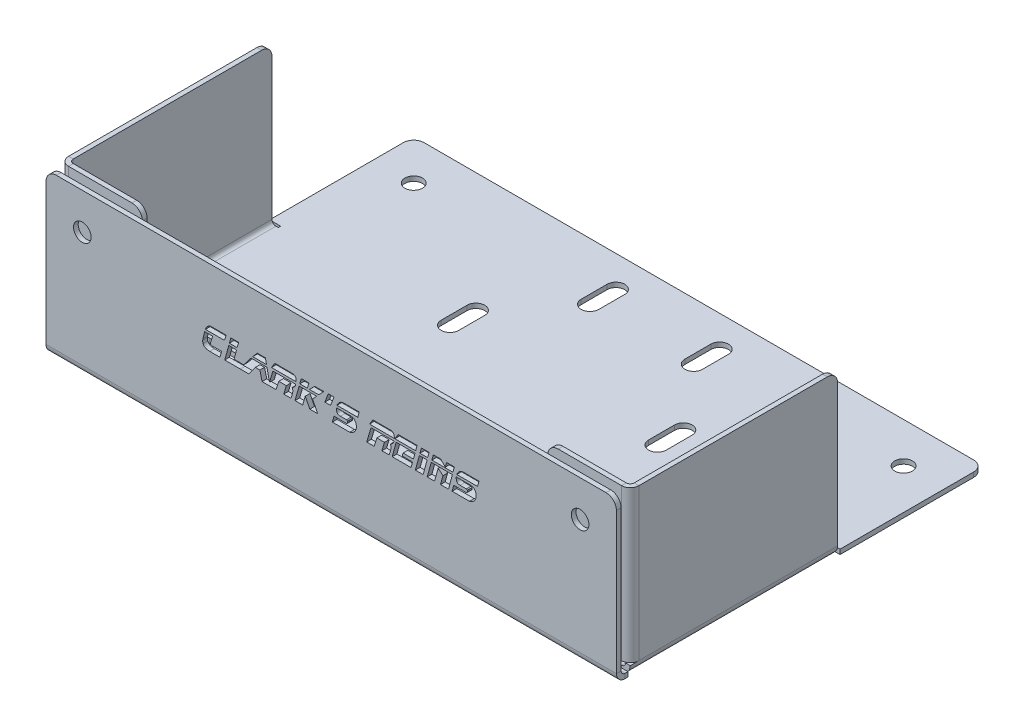
from build123d import *

# Parameters (mm, degrees)
SKETCH1_W                     = 110
SKETCH1_H                     = 70
BASE_FLANGE1_DEPTH            = 0.91
EDGE_FLANGE1_STRIP_W          = 5.164
EDGE_FLANGE1_STRIP_H          = 0.91
EDGE_FLANGE1_STRIP_CUT_DEPTH  = 110
EDGE_FLANGE1_DEPTH            = 110
EDGE_FLANGE2_STRIP_W          = 5.164
EDGE_FLANGE2_STRIP_H          = 0.91
EDGE_FLANGE2_STRIP_CUT_DEPTH  = 40
EDGE_FLANGE2_RELIEF_W         = 5.619
EDGE_FLANGE2_RELIEF_H         = 0.455
EDGE_FLANGE2_RELIEF_CUT_DEPTH = 0.91
EDGE_FLANGE2_DEPTH            = 40
EDGE_FLANGE3_START            = 0.762
EDGE_FLANGE3_DEPTH            = 29.238
EDGE_FLANGE3_2_DEPTH          = 29.238
M3_CLEARANCE_HOLE3_D          = 3.4
M3_CLEARANCE_HOLE1_D          = 3.4
COPY_OF_M3_HOLES_COPY_1_D     = 3.4
CLARK_S_REINS_DEPTH           = 0.91
M3_CLEARANCE_HOLE2_D          = 3.4
CUT_EXTRUDE2_DEPTH            = 134.790881707
M3_CLEARANCE_HOLE4_D          = 3.4
CUT_EXTRUDE3_DEPTH            = 134.790881707
FILLET1_R                     = 2


# Read off the part's stored shape, not the designer's step: Edge-Flange3
# Sheet-metal steps are written as plain solids
with BuildPart() as part:
    # Sketch1 → Base-Flange1 (new body)
    with BuildSketch(Plane(origin=(0, 0, 0), x_dir=(1, 0, 0), z_dir=(0, 1, 0))):
        with Locations((55, 35)):
            Rectangle(SKETCH1_W, SKETCH1_H)
    extrude(amount=-BASE_FLANGE1_DEPTH)

    # Edge-Flange1 strip (across the edge) → Edge-Flange1 strip cut (cut)
    with BuildSketch(Plane(origin=(0, 0, 0), x_dir=(0, 0, -1), z_dir=(1, 0, 0))):
        with Locations((-1.82, -0.455)):
            Rectangle(EDGE_FLANGE1_STRIP_W, EDGE_FLANGE1_STRIP_H)
    extrude(amount=EDGE_FLANGE1_STRIP_CUT_DEPTH, mode=Mode.SUBTRACT)

    # Edge-Flange1 section (across the edge) → Edge-Flange1 (add)
    with BuildSketch(Plane(origin=(0, 0, 0), x_dir=(0, 0, -1), z_dir=(1, 0, 0))):
        with BuildLine():
            Line((-0.91, 0.762), (-0.91, 30))
            Line((-0.91, 30), (0, 30))
            Line((0, 30), (0, 0.762))
            ThreePointArc((0, 0.762), (0.223184633, 0.223184633), (0.762, 0))
            Line((0.762, 0), (0.762, -0.91))
            ThreePointArc((0.762, -0.91), (-0.420282538, -0.420282538), (-0.91, 0.762))
        make_face()
    extrude(amount=EDGE_FLANGE1_DEPTH)

    # Edge-Flange2 strip (across the edge) → Edge-Flange2 strip cut (cut)
    with BuildSketch(Plane(origin=(110, 0, -1.762), x_dir=(-1, 0, 0), z_dir=(0, 0, -1))):
        with Locations((-0.91, -0.455)):
            Rectangle(EDGE_FLANGE2_STRIP_W, EDGE_FLANGE2_STRIP_H)
    edge_flange2_strip_cut = extrude(amount=EDGE_FLANGE2_STRIP_CUT_DEPTH, mode=Mode.SUBTRACT)

    # Edge-Flange2 relief (on the sheet) → Edge-Flange2 relief cut (cut)
    with BuildSketch(Plane(origin=(108.328, 0, -1.762), x_dir=(-1, 0, 0), z_dir=(0, 1, 0))):
        with Locations((-2.3545, 0.2275)):
            Rectangle(EDGE_FLANGE2_RELIEF_W, EDGE_FLANGE2_RELIEF_H)
        with Locations((-2.3545, -40.2275)):
            Rectangle(EDGE_FLANGE2_RELIEF_W, EDGE_FLANGE2_RELIEF_H)
    edge_flange2_relief_cut = extrude(amount=-EDGE_FLANGE2_RELIEF_CUT_DEPTH, mode=Mode.SUBTRACT)

    # Edge-Flange2 section (across the edge) → Edge-Flange2 (add)
    with BuildSketch(Plane(origin=(110, 0, -1.762), x_dir=(-1, 0, 0), z_dir=(0, 0, -1))):
        with BuildLine():
            Line((0, 0.762), (0, 30))
            Line((0, 30), (0.91, 30))
            Line((0.91, 30), (0.91, 0.762))
            ThreePointArc((0.91, 0.762), (1.133184633, 0.223184633), (1.672, 0))
            Line((1.672, 0), (1.672, -0.91))
            ThreePointArc((1.672, -0.91), (0.489717462, -0.420282538), (0, 0.762))
        make_face()
    edge_flange2 = extrude(amount=EDGE_FLANGE2_DEPTH)

    # Edge-Flange3 outline → Edge-Flange3 (cut)
    with BuildSketch(Plane(origin=(0, 0, 0), x_dir=(1, 0, 0), z_dir=(0, 1, 0)).offset(EDGE_FLANGE3_START)):
        with BuildLine():
            ThreePointArc((110, 3.434), (109.754472572, 2.56178443), (109.09, 1.945732551))
            Line((109.09, 1.945732551), (109.09, 1.762))
            Line((109.09, 1.762), (110, 1.762))
            Line((110, 1.762), (110, 3.434))
        make_face()
    edge_flange3 = extrude(amount=EDGE_FLANGE3_DEPTH, mode=Mode.SUBTRACT)

    # Edge-Flange3 2 outline → Edge-Flange3 2 (add)
    with BuildSketch(Plane(origin=(0, 0, 0), x_dir=(1, 0, 0), z_dir=(0, 1, 0)).offset(EDGE_FLANGE3_START)):
        with BuildLine():
            Line((94.09, 1.762), (108.328, 1.762))
            ThreePointArc((108.328, 1.762), (108.719918885, 1.808582027), (109.09, 1.945732551))
            Line((109.09, 1.945732551), (109.09, 3.434))
            ThreePointArc((109.09, 3.434), (108.866815367, 2.895184633), (108.328, 2.672))
            Line((108.328, 2.672), (94.09, 2.672))
            Line((94.09, 2.672), (94.09, 1.762))
        make_face()
    edge_flange3_2 = extrude(amount=EDGE_FLANGE3_2_DEPTH)

    # M3 Clearance Hole3 (through all)
    with Locations(Plane.XY.offset(0.91)):
        with Locations((103, 23)):
            m3_clearance_hole3 = Hole(M3_CLEARANCE_HOLE3_D / 2)

    # Mirror6: Edge-Flange2 strip cut, Edge-Flange2 relief cut, Edge-Flange2, Edge-Flange3, Edge-Flange3 2, M3 Clearance Hole3 across plane
    add(edge_flange2_strip_cut.mirror(Plane(origin=(55, 0, 0), x_dir=(0, 0, 1), z_dir=(1, 0, 0))), mode=Mode.SUBTRACT)
    add(edge_flange2_relief_cut.mirror(Plane(origin=(55, 0, 0), x_dir=(0, 0, 1), z_dir=(1, 0, 0))), mode=Mode.SUBTRACT)
    add(edge_flange2.mirror(Plane(origin=(55, 0, 0), x_dir=(0, 0, 1), z_dir=(1, 0, 0))))
    add(edge_flange3.mirror(Plane(origin=(55, 0, 0), x_dir=(0, 0, 1), z_dir=(1, 0, 0))), mode=Mode.SUBTRACT)
    add(edge_flange3_2.mirror(Plane(origin=(55, 0, 0), x_dir=(0, 0, 1), z_dir=(1, 0, 0))))
    add(m3_clearance_hole3.mirror(Plane(origin=(55, 0, 0), x_dir=(0, 0, 1), z_dir=(1, 0, 0))), mode=Mode.SUBTRACT)

    # M3 Clearance Hole1 (through all)
    with Locations(Plane(origin=(0, 0, 0), x_dir=(1, 0, 0), z_dir=(0, 1, 0))):
        with Locations((7.762, 62.238)):
            m3_clearance_hole1 = Hole(M3_CLEARANCE_HOLE1_D / 2)

    # Copy of M3 Hole: M3 Clearance Hole1 across plane
    add(m3_clearance_hole1.mirror(Plane.XY.offset(-35)), mode=Mode.SUBTRACT)

    # Copy of M3 Holes: M3 Clearance Hole1 across plane
    add(m3_clearance_hole1.mirror(Plane(origin=(55, 0, 0), x_dir=(0, 0, 1), z_dir=(1, 0, 0))), mode=Mode.SUBTRACT)

    # Copy of M3 Holes copy 1 (through all)
    with Locations(Plane(origin=(110, 0, -70), x_dir=(-1, 0, 0), z_dir=(0, 1, 0))):
        with Locations((7.762, 62.238)):
            Hole(COPY_OF_M3_HOLES_COPY_1_D / 2)

    # Sketch28 → Clark's Reins (cut)
    with BuildSketch(Plane.XY.offset(0.91)):
        with BuildLine():
            Line((34.736062337, 19.669454861), (34.431403356, 18.640225694))
            Line((34.431403356, 18.640225694), (30.735291323, 18.640225694))
            add(Edge.make_bspline(
                [(30.735291323, 18.640225694), (30.74517346, 18.671694178), (30.764938942, 18.734634998), (30.804303251, 18.825411557), (30.847787537, 18.9148253), (30.899310195, 19.001043126), (30.955283862, 19.086211161), (31.018039553, 19.168792297), (31.088027933, 19.248090393), (31.137991213, 19.298907773), (31.163243381, 19.324591616)],
                knots=[0, 0, 0, 0, 0.969584053, 1.939286824, 2.906969419, 3.892567764, 4.891161531, 5.903872825, 6.940586855, 8, 8, 8, 8], degree=3))
            add(Edge.make_bspline(
                [(31.163243381, 19.324591616), (31.192365751, 19.35179938), (31.249227354, 19.404922702), (31.338382225, 19.47581139), (31.429517546, 19.535232057), (31.52081533, 19.584388093), (31.613235366, 19.622770424), (31.706450108, 19.6494867), (31.800837249, 19.666363866), (31.864217987, 19.668425699), (31.89585442, 19.669454861)],
                knots=[0, 0, 0, 0, 1.151042241, 2.247416924, 3.285395898, 4.289929018, 5.238920285, 6.170118847, 7.086616619, 8, 8, 8, 8], degree=3))
            Line((31.89585442, 19.669454861), (34.736062337, 19.669454861))
        make_face()
        with BuildLine():
            Line((33.861396231, 16.524587963), (33.538868689, 15.381))
            Line((33.538868689, 15.381), (31.582261158, 15.381))
            add(Edge.make_bspline(
                [(31.582261158, 15.381), (31.540859722, 15.381606912), (31.459781603, 15.382795453), (31.341018016, 15.389370623), (31.228097249, 15.403225568), (31.120786119, 15.421067928), (31.018689685, 15.442610801), (30.923173077, 15.471729298), (30.833073298, 15.504497816), (30.749124078, 15.543265244), (30.670066293, 15.58569746), (30.597342687, 15.634471076), (30.529994349, 15.687859652), (30.469276495, 15.747369075), (30.413365998, 15.811041222), (30.363218656, 15.879977306), (30.319186131, 15.954170897), (30.295252775, 16.006756996), (30.283216706, 16.03320251)],
                knots=[0, 0, 0, 0, 1.285130438, 2.516723288, 3.689614434, 4.814121375, 5.892908561, 6.925234272, 7.910815483, 8.866288762, 9.792843532, 10.692686491, 11.58048512, 12.456415222, 13.327699743, 14.207765629, 15.098686514, 16, 16, 16, 16], degree=3))
            add(Edge.make_bspline(
                [(30.283216706, 16.03320251), (30.270503366, 16.068641638), (30.243279643, 16.14452925), (30.223859175, 16.272814612), (30.217949637, 16.41923666), (30.22498601, 16.522524068), (30.228717593, 16.577300221)],
                knots=[0, 0, 0, 0, 0.817267469, 1.750056471, 2.806793075, 4, 4, 4, 4], degree=3))
            add(Edge.make_bspline(
                [(30.228717593, 16.577300221), (30.230261322, 16.590993738), (30.233883209, 16.623121382), (30.238518779, 16.678058636), (30.247485204, 16.746388766), (30.252678106, 16.796472886), (30.255520435, 16.823886375)],
                knots=[0, 0, 0, 0, 0.666647788, 1.56408479, 2.666704423, 4, 4, 4, 4], degree=3))
            Line((30.255520435, 16.823886375), (30.61467853, 18.194405075))
            Line((30.61467853, 18.194405075), (32.146014287, 18.203339355))
            Line((32.146014287, 18.203339355), (31.702873951, 16.838181225))
            add(Edge.make_bspline(
                [(31.702873951, 16.838181225), (31.709864958, 16.811114751), (31.723811967, 16.757117322), (31.736070769, 16.702711801), (31.742184787, 16.675577311)],
                knots=[0, 0, 0, 0, 1.002509712, 2, 2, 2, 2], degree=3))
            add(Edge.make_bspline(
                [(31.742184787, 16.675577311), (31.753162774, 16.65725451), (31.775499957, 16.619972651), (31.828281271, 16.576523619), (31.894578281, 16.54418357), (31.944375778, 16.531398458), (31.97090238, 16.524587963)],
                knots=[0, 0, 0, 0, 0.898606002, 1.828415905, 2.843220022, 4, 4, 4, 4], degree=3))
            Line((31.97090238, 16.524587963), (33.861396231, 16.524587963))
        make_face()
        Polygon((37.161719618, 19.669454861), (36.857060637, 18.640225694), (35.361462004, 18.640225694), (35.644678711, 19.66052058), align=None)
        Polygon((38.324962999, 16.410229167), (37.462804886, 15.381), (34.459993056, 15.381), (35.256037489, 18.203339355), (36.754316406, 18.203339355), (36.259357241, 16.410229167), align=None)
        Polygon((42.525861907, 18.640225694), (39.860765896, 18.640225694), (40.747046568, 19.669454861), (42.306078595, 19.669454861), align=None)
        Polygon((43.213801541, 15.381), (41.663703794, 15.381), (41.244686017, 17.096381944), (40.370019911, 17.096381944), (39.128154857, 15.381), (37.318962963, 15.383680284), (39.529304073, 18.239969907), (42.610737576, 18.239969907), align=None)
        with BuildLine():
            Line((48.250949146, 18.640225694), (43.464854836, 18.640225694))
            Line((43.464854836, 18.640225694), (44.118844202, 19.669454861))
            Line((44.118844202, 19.669454861), (47.632696904, 19.669454861))
            add(Edge.make_bspline(
                [(47.632696904, 19.669454861), (47.656663709, 19.66829251), (47.705680326, 19.665915283), (47.778933037, 19.644279786), (47.853502533, 19.612573905), (47.900528513, 19.582343971), (47.924847891, 19.56671063)],
                knots=[0, 0, 0, 0, 0.913581768, 1.868446239, 2.897671833, 4, 4, 4, 4], degree=3))
            add(Edge.make_bspline(
                [(47.924847891, 19.56671063), (47.947610654, 19.550257082), (47.992079184, 19.518114012), (48.050301072, 19.46204597), (48.100522146, 19.402172921), (48.12644398, 19.358042712), (48.139270634, 19.336206181)],
                knots=[0, 0, 0, 0, 1.059583365, 2.069964611, 3.044978977, 4, 4, 4, 4], degree=3))
            add(Edge.make_bspline(
                [(48.139270634, 19.336206181), (48.14825905, 19.317896274), (48.167423646, 19.278856914), (48.190120117, 19.21384992), (48.208421048, 19.139537435), (48.224770391, 19.057039352), (48.235575845, 18.965297782), (48.244801392, 18.864931181), (48.249973515, 18.755531415), (48.250616486, 18.679541355), (48.250949146, 18.640225694)],
                knots=[0, 0, 0, 0, 0.68813208, 1.467196756, 2.318188026, 3.270514463, 4.304265893, 5.434736438, 6.672786523, 8, 8, 8, 8], degree=3))
        make_face()
        with BuildLine():
            add(Edge.make_bspline(
                [(48.178581471, 18.182790509), (48.173358263, 18.151650574), (48.162815637, 18.08879711), (48.133300134, 17.996770032), (48.094803328, 17.906102571), (48.046003892, 17.816948674), (47.98661799, 17.729162974), (47.916681992, 17.642815726), (47.837064733, 17.557249359), (47.777586363, 17.504208538), (47.7470557, 17.476982313)],
                knots=[0, 0, 0, 0, 0.89522961, 1.806949233, 2.734865869, 3.688117976, 4.686871091, 5.73903451, 6.839430601, 8, 8, 8, 8], degree=3))
            add(Edge.make_bspline(
                [(47.7470557, 17.476982313), (47.719040473, 17.453398062), (47.667046277, 17.40962743), (47.59050215, 17.353668867), (47.522639018, 17.310475715), (47.477775756, 17.290986245), (47.457584997, 17.282214988)],
                knots=[0, 0, 0, 0, 1.253750942, 2.326869253, 3.247005745, 4, 4, 4, 4], degree=3))
            add(Edge.make_bspline(
                [(47.457584997, 17.282214988), (47.47961959, 17.245581686), (47.522590541, 17.174140935), (47.566260764, 17.058045194), (47.594498802, 16.939909272), (47.597930524, 16.859483834), (47.599640064, 16.819419235)],
                knots=[0, 0, 0, 0, 1.043583065, 2.035152543, 3.021194923, 4, 4, 4, 4], degree=3))
            add(Edge.make_bspline(
                [(47.599640064, 16.819419235), (47.599039945, 16.793195464), (47.597721565, 16.735585467), (47.588680722, 16.642383353), (47.576657428, 16.534399133), (47.564268252, 16.458127252), (47.557648944, 16.417376591)],
                knots=[0, 0, 0, 0, 0.77775057, 1.708610381, 2.775752775, 4, 4, 4, 4], degree=3))
            add(Edge.make_bspline(
                [(47.557648944, 16.417376591), (47.554256562, 16.400062065), (47.545946084, 16.357645849), (47.525461333, 16.283905826), (47.496356798, 16.187960767), (47.460010249, 16.069631519), (47.415059801, 15.928756613), (47.36146186, 15.765946015), (47.29986242, 15.580590046), (47.255183517, 15.450055035), (47.231547689, 15.381)],
                knots=[0, 0, 0, 0, 0.389472445, 0.95410909, 1.688508646, 2.603699675, 3.68718707, 4.953583, 6.388398418, 8, 8, 8, 8], degree=3))
            Line((47.231547689, 15.381), (45.847627568, 15.381))
            Line((45.847627568, 15.381), (46.341693305, 17.039202546))
            Line((46.341693305, 17.039202546), (44.885405509, 17.039202546))
            Line((44.885405509, 17.039202546), (44.360963216, 15.381))
            Line((44.360963216, 15.381), (42.922543981, 15.381))
            Line((42.922543981, 15.381), (43.751645255, 18.182790509))
            Line((43.751645255, 18.182790509), (48.178581471, 18.182790509))
        make_face()
        Polygon((53.578460883, 19.669454861), (52.592116265, 18.640225694), (50.804366645, 18.640225694), (51.808579825, 19.669454861), align=None)
        Polygon((50.701622414, 19.669454861), (50.405897714, 18.640225694), (48.940675637, 18.640225694), (49.236400336, 19.669454861), align=None)
        Polygon((52.410750362, 15.381), (50.869586896, 15.381), (49.998494502, 17.106209654), (49.504428765, 15.381), (48.011510417, 15.381), (48.825423412, 18.203339355), (52.217769893, 18.203339355), (51.392242332, 17.368877514), align=None)
        Polygon((54.429897859, 19.726634259), (55.532388129, 19.726634259), (54.877505335, 18.011252315), (53.775015064, 18.011252315), align=None)
        with BuildLine():
            Line((60.3935304, 19.669454861), (60.119247975, 18.640225694))
            Line((60.119247975, 18.640225694), (56.114903248, 18.640225694))
            add(Edge.make_bspline(
                [(56.114903248, 18.640225694), (56.125706931, 18.671695495), (56.147336369, 18.734699387), (56.189098817, 18.825740916), (56.236817243, 18.914965542), (56.290868566, 19.002008472), (56.35227273, 19.086628407), (56.420157937, 19.168538652), (56.494563073, 19.248691823), (56.548490825, 19.29900715), (56.575912146, 19.324591616)],
                knots=[0, 0, 0, 0, 0.956209675, 1.914372872, 2.87597378, 3.864460707, 4.857942359, 5.879804516, 6.921917604, 8, 8, 8, 8], degree=3))
            add(Edge.make_bspline(
                [(56.575912146, 19.324591616), (56.60741799, 19.351833094), (56.669075827, 19.405145443), (56.765299971, 19.475747045), (56.862820446, 19.535332817), (56.960583881, 19.584737413), (57.059726465, 19.622640472), (57.159103073, 19.649425134), (57.259396877, 19.666426392), (57.326623194, 19.668443258), (57.360342014, 19.669454861)],
                knots=[0, 0, 0, 0, 1.139603552, 2.230236676, 3.261863858, 4.264259599, 5.223960264, 6.161141691, 7.077680667, 8, 8, 8, 8], degree=3))
            Line((57.360342014, 19.669454861), (60.3935304, 19.669454861))
        make_face()
        with BuildLine():
            add(Edge.make_bspline(
                [(59.836031268, 16.706847295), (59.831055707, 16.666160344), (59.821067204, 16.584480761), (59.788029782, 16.464330362), (59.745886159, 16.344736606), (59.688299336, 16.227664851), (59.620503379, 16.110591894), (59.538525233, 15.996005247), (59.445731324, 15.881391008), (59.37535503, 15.809870936), (59.339285247, 15.773214934)],
                knots=[0, 0, 0, 0, 0.910421112, 1.827682268, 2.764157645, 3.72689346, 4.724227412, 5.769787089, 6.856954621, 8, 8, 8, 8], degree=3))
            add(Edge.make_bspline(
                [(59.339285247, 15.773214934), (59.317631911, 15.752519871), (59.273225479, 15.710078655), (59.197515555, 15.653457613), (59.11399518, 15.599846724), (59.022807563, 15.548884512), (58.923168709, 15.501355123), (58.81483156, 15.458188391), (58.69880596, 15.416628528), (58.617830537, 15.393078818), (58.576297653, 15.381)],
                knots=[0, 0, 0, 0, 0.828618772, 1.699322615, 2.61184683, 3.575250122, 4.589426627, 5.665778724, 6.802760923, 8, 8, 8, 8], degree=3))
            Line((58.576297653, 15.381), (55.216114583, 15.389934281))
            Line((55.216114583, 15.389934281), (55.545789551, 16.560325087))
            Line((55.545789551, 16.560325087), (57.886571162, 16.524587963))
            add(Edge.make_bspline(
                [(57.886571162, 16.524587963), (57.910246456, 16.528088224), (57.955292824, 16.534748081), (58.017561107, 16.554712692), (58.071549091, 16.58068722), (58.114225432, 16.616834605), (58.148991536, 16.659054589), (58.172624564, 16.709742735), (58.187536143, 16.76765096), (58.188785789, 16.808596821), (58.189443287, 16.830140372)],
                knots=[0, 0, 0, 0, 1.192376395, 2.26870371, 3.252393677, 4.160059601, 5.037409856, 5.961355377, 6.927372829, 8, 8, 8, 8], degree=3))
            add(Edge.make_bspline(
                [(58.189443287, 16.830140372), (58.189167854, 16.853987162), (58.188667749, 16.897285763), (58.183708942, 16.955545464), (58.1753402, 17.001229902), (58.163932523, 17.025343502), (58.159066732, 17.035628834)],
                knots=[0, 0, 0, 0, 1.364590242, 2.477685587, 3.350677278, 4, 4, 4, 4], degree=3))
            add(Edge.make_bspline(
                [(58.159066732, 17.035628834), (58.150661048, 17.046895001), (58.131704333, 17.072302753), (58.086386545, 17.100966455), (58.028569785, 17.130114744), (57.983635132, 17.145245441), (57.958938838, 17.153561343)],
                knots=[0, 0, 0, 0, 0.708538637, 1.597914665, 2.679802781, 4, 4, 4, 4], degree=3))
            Line((57.958938838, 17.153561343), (56.762638618, 17.153561343))
            add(Edge.make_bspline(
                [(56.762638618, 17.153561343), (56.731346851, 17.153979459), (56.670709756, 17.154789685), (56.583143796, 17.16372828), (56.501808878, 17.178861168), (56.427041478, 17.200152108), (56.358261955, 17.226891383), (56.296042807, 17.260036587), (56.240512506, 17.299692657), (56.190267594, 17.344639074), (56.147291628, 17.397426731), (56.109166261, 17.456792971), (56.078259906, 17.524696185), (56.052300451, 17.599729534), (56.033076431, 17.68245043), (56.018927589, 17.772314303), (56.009752318, 17.869603826), (56.008982893, 17.937076174), (56.008585305, 17.971941479)],
                knots=[0, 0, 0, 0, 1.166842435, 2.261103934, 3.278525226, 4.248956773, 5.156576421, 6.026289423, 6.87080885, 7.696489042, 8.532786248, 9.401789569, 10.321161014, 11.308296568, 12.359069103, 13.484023017, 14.699907341, 16, 16, 16, 16], degree=3))
            add(Edge.make_bspline(
                [(56.008585305, 17.971941479), (56.007107065, 17.988321486), (56.00433957, 18.018987413), (56.000314582, 18.061820966), (55.998921263, 18.098222444), (55.997463261, 18.127941107), (55.998440298, 18.151098325), (55.999937726, 18.167258536), (56.002340963, 18.17865141), (56.006954062, 18.181709231), (56.008585305, 18.182790509)],
                knots=[0, 0, 0, 0, 1.84323671, 3.450826295, 4.820859661, 5.922765388, 6.791176808, 7.395637569, 7.786290849, 8, 8, 8, 8], degree=3))
            Line((56.008585305, 18.182790509), (58.727287001, 18.182790509))
            add(Edge.make_bspline(
                [(58.727287001, 18.182790509), (58.767233333, 18.177089138), (58.843730438, 18.166171031), (58.953080403, 18.146443472), (59.052342207, 18.125114611), (59.141983252, 18.102293765), (59.221400963, 18.076636297), (59.290546952, 18.0487441), (59.35043014, 18.020375946), (59.384224378, 17.996510644), (59.400038357, 17.9853429)],
                knots=[0, 0, 0, 0, 1.369144754, 2.621908043, 3.769545441, 4.813699606, 5.759636069, 6.598458342, 7.344149999, 8, 8, 8, 8], degree=3))
            add(Edge.make_bspline(
                [(59.400038357, 17.9853429), (59.403627093, 17.981783905), (59.413647387, 17.971846654), (59.432843616, 17.95143428), (59.461127733, 17.921352086), (59.498952128, 17.881392664), (59.543736166, 17.829808707), (59.600024094, 17.770711442), (59.662857456, 17.699340719), (59.708767526, 17.649323916), (59.733287037, 17.622611093)],
                knots=[0, 0, 0, 0, 0.246230822, 0.687513659, 1.364959245, 2.258076485, 3.367823802, 4.692308244, 6.233438043, 8, 8, 8, 8], degree=3))
            add(Edge.make_bspline(
                [(59.733287037, 17.622611093), (59.75106569, 17.572305408), (59.787256835, 17.469900552), (59.821705484, 17.3069853), (59.8439038, 17.134527735), (59.846376389, 17.016048417), (59.847645833, 16.955220305)],
                knots=[0, 0, 0, 0, 0.939554019, 1.912604809, 2.92831669, 4, 4, 4, 4], degree=3))
            add(Edge.make_bspline(
                [(59.847645833, 16.955220305), (59.847271215, 16.913800558), (59.846521099, 16.830863682), (59.839530614, 16.748218437), (59.836031268, 16.706847295)],
                knots=[0, 0, 0, 0, 0.998825835, 2, 2, 2, 2], degree=3))
        make_face()
        with BuildLine():
            Line((67.177329933, 18.640225694), (62.391235623, 18.640225694))
            Line((62.391235623, 18.640225694), (63.045224989, 19.669454861))
            Line((63.045224989, 19.669454861), (66.559077691, 19.669454861))
            add(Edge.make_bspline(
                [(66.559077691, 19.669454861), (66.583044496, 19.66829251), (66.632061113, 19.665915283), (66.705313824, 19.644279786), (66.77988332, 19.612573905), (66.8269093, 19.582343971), (66.851228678, 19.56671063)],
                knots=[0, 0, 0, 0, 0.913581768, 1.868446239, 2.897671833, 4, 4, 4, 4], degree=3))
            add(Edge.make_bspline(
                [(66.851228678, 19.56671063), (66.873991441, 19.550257082), (66.918459971, 19.518114012), (66.976681859, 19.46204597), (67.026902933, 19.402172921), (67.052824767, 19.358042712), (67.065651421, 19.336206181)],
                knots=[0, 0, 0, 0, 1.059583365, 2.069964611, 3.044978977, 4, 4, 4, 4], degree=3))
            add(Edge.make_bspline(
                [(67.065651421, 19.336206181), (67.074639837, 19.317896274), (67.093804433, 19.278856914), (67.116500904, 19.21384992), (67.134801835, 19.139537435), (67.151151178, 19.057039352), (67.161956632, 18.965297782), (67.171182179, 18.864931181), (67.176354302, 18.755531415), (67.176997273, 18.679541355), (67.177329933, 18.640225694)],
                knots=[0, 0, 0, 0, 0.68813208, 1.467196756, 2.318188026, 3.270514463, 4.304265893, 5.434736438, 6.672786523, 8, 8, 8, 8], degree=3))
        make_face()
        with BuildLine():
            add(Edge.make_bspline(
                [(67.104962258, 18.182790509), (67.09973905, 18.151650574), (67.089196424, 18.08879711), (67.059680921, 17.996770032), (67.021184115, 17.906102571), (66.97238468, 17.816948674), (66.912998777, 17.729162974), (66.843062779, 17.642815726), (66.76344552, 17.557249359), (66.70396715, 17.504208538), (66.673436487, 17.476982313)],
                knots=[0, 0, 0, 0, 0.89522961, 1.806949233, 2.734865869, 3.688117976, 4.686871091, 5.73903451, 6.839430601, 8, 8, 8, 8], degree=3))
            add(Edge.make_bspline(
                [(66.673436487, 17.476982313), (66.64542126, 17.453398062), (66.593427064, 17.40962743), (66.516882937, 17.353668867), (66.449019805, 17.310475715), (66.404156543, 17.290986245), (66.383965784, 17.282214988)],
                knots=[0, 0, 0, 0, 1.253750942, 2.326869253, 3.247005745, 4, 4, 4, 4], degree=3))
            add(Edge.make_bspline(
                [(66.383965784, 17.282214988), (66.406000377, 17.245581686), (66.448971328, 17.174140935), (66.492641551, 17.058045194), (66.520879589, 16.939909272), (66.524311311, 16.859483834), (66.526020851, 16.819419235)],
                knots=[0, 0, 0, 0, 1.043583065, 2.035152543, 3.021194923, 4, 4, 4, 4], degree=3))
            add(Edge.make_bspline(
                [(66.526020851, 16.819419235), (66.525420732, 16.793195464), (66.524102352, 16.735585467), (66.515061509, 16.642383353), (66.503038215, 16.534399133), (66.490649039, 16.458127252), (66.484029731, 16.417376591)],
                knots=[0, 0, 0, 0, 0.77775057, 1.708610381, 2.775752775, 4, 4, 4, 4], degree=3))
            add(Edge.make_bspline(
                [(66.484029731, 16.417376591), (66.480637349, 16.400062065), (66.472326871, 16.357645849), (66.45184212, 16.283905826), (66.422737585, 16.187960767), (66.386391036, 16.069631519), (66.341440588, 15.928756613), (66.287842647, 15.765946015), (66.226243207, 15.580590046), (66.181564304, 15.450055035), (66.157928476, 15.381)],
                knots=[0, 0, 0, 0, 0.389472445, 0.95410909, 1.688508646, 2.603699675, 3.68718707, 4.953583, 6.388398418, 8, 8, 8, 8], degree=3))
            Line((66.157928476, 15.381), (64.774008355, 15.381))
            Line((64.774008355, 15.381), (65.268074092, 17.039202546))
            Line((65.268074092, 17.039202546), (63.811786296, 17.039202546))
            Line((63.811786296, 17.039202546), (63.287344003, 15.381))
            Line((63.287344003, 15.381), (61.848924769, 15.381))
            Line((61.848924769, 15.381), (62.678026042, 18.182790509))
            Line((62.678026042, 18.182790509), (67.104962258, 18.182790509))
        make_face()
        Polygon((71.563168457, 19.669454861), (71.288886032, 18.640225694), (67.266672743, 18.640225694), (67.92959639, 19.669454861), align=None)
        Polygon((71.162019242, 18.182790509), (70.863614258, 17.039202546), (68.862335323, 17.039202546), (68.696157697, 16.467408565), (70.688502351, 16.467408565), (70.390097367, 15.381), (66.766353009, 15.381), (67.520406322, 18.182790509), align=None)
        Polygon((73.877147226, 19.669454861), (73.593930519, 18.640225694), (72.107266168, 18.640225694), (72.402990867, 19.669454861), align=None)
        Polygon((73.502800854, 18.203339355), (72.728198694, 15.381), (71.226346065, 15.381), (72.009882505, 18.203339355), align=None)
        Polygon((78.759731771, 19.669454861), (78.45507279, 18.640225694), (74.408736943, 18.640225694), (74.70088793, 19.669454861), (76.103570041, 19.669454861), (77.016653555, 18.773346481), (77.237330295, 19.669454861), align=None)
        Polygon((78.371090549, 18.203339355), (77.620610948, 15.381), (76.070513202, 15.381), (76.546710377, 17.09370166), (75.642561144, 17.916548937), (74.924244954, 15.381), (73.513521991, 15.381), (74.285443866, 18.203339355), align=None)
        with BuildLine():
            Line((83.494007252, 19.669454861), (83.219724826, 18.640225694))
            Line((83.219724826, 18.640225694), (79.2153801, 18.640225694))
            add(Edge.make_bspline(
                [(79.2153801, 18.640225694), (79.226183783, 18.671695495), (79.247813221, 18.734699387), (79.289575669, 18.825740916), (79.337294095, 18.914965542), (79.391345418, 19.002008472), (79.452749582, 19.086628407), (79.520634789, 19.168538652), (79.595039925, 19.248691823), (79.648967677, 19.29900715), (79.676388997, 19.324591616)],
                knots=[0, 0, 0, 0, 0.956209675, 1.914372872, 2.87597378, 3.864460707, 4.857942359, 5.879804516, 6.921917604, 8, 8, 8, 8], degree=3))
            add(Edge.make_bspline(
                [(79.676388997, 19.324591616), (79.707894842, 19.351833094), (79.769552679, 19.405145443), (79.865776823, 19.475747045), (79.963297298, 19.535332817), (80.061060733, 19.584737413), (80.160203317, 19.622640472), (80.259579925, 19.649425134), (80.359873729, 19.666426392), (80.427100046, 19.668443258), (80.460818866, 19.669454861)],
                knots=[0, 0, 0, 0, 1.139603552, 2.230236676, 3.261863858, 4.264259599, 5.223960264, 6.161141691, 7.077680667, 8, 8, 8, 8], degree=3))
            Line((80.460818866, 19.669454861), (83.494007252, 19.669454861))
        make_face()
        with BuildLine():
            add(Edge.make_bspline(
                [(82.93650812, 16.706847295), (82.931532559, 16.666160344), (82.921544056, 16.584480761), (82.888506634, 16.464330362), (82.846363011, 16.344736606), (82.788776188, 16.227664851), (82.720980231, 16.110591894), (82.639002085, 15.996005247), (82.546208176, 15.881391008), (82.475831882, 15.809870936), (82.439762099, 15.773214934)],
                knots=[0, 0, 0, 0, 0.910421112, 1.827682268, 2.764157645, 3.72689346, 4.724227412, 5.769787089, 6.856954621, 8, 8, 8, 8], degree=3))
            add(Edge.make_bspline(
                [(82.439762099, 15.773214934), (82.418108763, 15.752519871), (82.373702331, 15.710078655), (82.297992407, 15.653457613), (82.214472032, 15.599846724), (82.123284415, 15.548884512), (82.023645561, 15.501355123), (81.915308412, 15.458188391), (81.799282812, 15.416628528), (81.718307389, 15.393078818), (81.676774504, 15.381)],
                knots=[0, 0, 0, 0, 0.828618772, 1.699322615, 2.61184683, 3.575250122, 4.589426627, 5.665778724, 6.802760923, 8, 8, 8, 8], degree=3))
            Line((81.676774504, 15.381), (78.316591435, 15.389934281))
            Line((78.316591435, 15.389934281), (78.646266403, 16.560325087))
            Line((78.646266403, 16.560325087), (80.987048014, 16.524587963))
            add(Edge.make_bspline(
                [(80.987048014, 16.524587963), (81.010723308, 16.528088224), (81.055769676, 16.534748081), (81.118037959, 16.554712692), (81.172025943, 16.58068722), (81.214702283, 16.616834605), (81.249468388, 16.659054589), (81.273101415, 16.709742735), (81.288012994, 16.76765096), (81.289262641, 16.808596821), (81.289920139, 16.830140372)],
                knots=[0, 0, 0, 0, 1.192376395, 2.26870371, 3.252393677, 4.160059601, 5.037409856, 5.961355377, 6.927372829, 8, 8, 8, 8], degree=3))
            add(Edge.make_bspline(
                [(81.289920139, 16.830140372), (81.289644705, 16.853987162), (81.289144601, 16.897285763), (81.284185794, 16.955545464), (81.275817052, 17.001229902), (81.264409375, 17.025343502), (81.259543584, 17.035628834)],
                knots=[0, 0, 0, 0, 1.364590242, 2.477685587, 3.350677278, 4, 4, 4, 4], degree=3))
            add(Edge.make_bspline(
                [(81.259543584, 17.035628834), (81.2511379, 17.046895001), (81.232181185, 17.072302753), (81.186863397, 17.100966455), (81.129046637, 17.130114744), (81.084111983, 17.145245441), (81.05941569, 17.153561343)],
                knots=[0, 0, 0, 0, 0.708538637, 1.597914665, 2.679802781, 4, 4, 4, 4], degree=3))
            Line((81.05941569, 17.153561343), (79.863115469, 17.153561343))
            add(Edge.make_bspline(
                [(79.863115469, 17.153561343), (79.831823703, 17.153979459), (79.771186608, 17.154789685), (79.683620648, 17.16372828), (79.60228573, 17.178861168), (79.52751833, 17.200152108), (79.458738807, 17.226891383), (79.396519659, 17.260036587), (79.340989357, 17.299692657), (79.290744446, 17.344639074), (79.24776848, 17.397426731), (79.209643113, 17.456792971), (79.178736757, 17.524696185), (79.152777303, 17.599729534), (79.133553283, 17.68245043), (79.11940444, 17.772314303), (79.11022917, 17.869603826), (79.109459745, 17.937076174), (79.109062156, 17.971941479)],
                knots=[0, 0, 0, 0, 1.166842435, 2.261103934, 3.278525226, 4.248956773, 5.156576421, 6.026289423, 6.87080885, 7.696489042, 8.532786248, 9.401789569, 10.321161014, 11.308296568, 12.359069103, 13.484023017, 14.699907341, 16, 16, 16, 16], degree=3))
            add(Edge.make_bspline(
                [(79.109062156, 17.971941479), (79.107583917, 17.988321486), (79.104816422, 18.018987413), (79.100791433, 18.061820966), (79.099398115, 18.098222444), (79.097940113, 18.127941107), (79.09891715, 18.151098325), (79.100414578, 18.167258536), (79.102817815, 18.17865141), (79.107430914, 18.181709231), (79.109062156, 18.182790509)],
                knots=[0, 0, 0, 0, 1.84323671, 3.450826295, 4.820859661, 5.922765388, 6.791176808, 7.395637569, 7.786290849, 8, 8, 8, 8], degree=3))
            Line((79.109062156, 18.182790509), (81.827763853, 18.182790509))
            add(Edge.make_bspline(
                [(81.827763853, 18.182790509), (81.867710185, 18.177089138), (81.94420729, 18.166171031), (82.053557255, 18.146443472), (82.152819059, 18.125114611), (82.242460104, 18.102293765), (82.321877815, 18.076636297), (82.391023804, 18.0487441), (82.450906992, 18.020375946), (82.48470123, 17.996510644), (82.500515209, 17.9853429)],
                knots=[0, 0, 0, 0, 1.369144754, 2.621908043, 3.769545441, 4.813699606, 5.759636069, 6.598458342, 7.344149999, 8, 8, 8, 8], degree=3))
            add(Edge.make_bspline(
                [(82.500515209, 17.9853429), (82.504103945, 17.981783905), (82.514124239, 17.971846654), (82.533320468, 17.95143428), (82.561604585, 17.921352086), (82.59942898, 17.881392664), (82.644213018, 17.829808707), (82.700500946, 17.770711442), (82.763334308, 17.699340719), (82.809244378, 17.649323916), (82.833763889, 17.622611093)],
                knots=[0, 0, 0, 0, 0.246230822, 0.687513659, 1.364959245, 2.258076485, 3.367823802, 4.692308244, 6.233438043, 8, 8, 8, 8], degree=3))
            add(Edge.make_bspline(
                [(82.833763889, 17.622611093), (82.851542541, 17.572305408), (82.887733687, 17.469900552), (82.922182336, 17.3069853), (82.944380652, 17.134527735), (82.946853241, 17.016048417), (82.948122685, 16.955220305)],
                knots=[0, 0, 0, 0, 0.939554019, 1.912604809, 2.92831669, 4, 4, 4, 4], degree=3))
            add(Edge.make_bspline(
                [(82.948122685, 16.955220305), (82.947748067, 16.913800558), (82.946997951, 16.830863682), (82.940007466, 16.748218437), (82.93650812, 16.706847295)],
                knots=[0, 0, 0, 0, 0.998825835, 2, 2, 2, 2], degree=3))
        make_face()
    extrude(amount=-CLARK_S_REINS_DEPTH, mode=Mode.SUBTRACT)

    # M3 Clearance Hole2 (through all)
    with Locations(Plane(origin=(0, 0, 0), x_dir=(1, 0, 0), z_dir=(0, 1, 0))):
        with Locations((45, 61.5), (65, 61.5), (35, 44.5), (75, 44.5)):
            Hole(M3_CLEARANCE_HOLE2_D / 2)

    # Sketch33 → Cut-Extrude2 (cut, through all)
    with BuildSketch(Plane(origin=(0, 0, 0), x_dir=(1, 0, 0), z_dir=(0, 1, 0))):
        with BuildLine():
            Line((36.7, 47), (36.7, 42))
            ThreePointArc((36.7, 42), (35, 40.3), (33.3, 42))
            Line((33.3, 42), (33.3, 47))
            ThreePointArc((33.3, 47), (35, 48.7), (36.7, 47))
        make_face()
        with BuildLine():
            Line((46.7, 64), (46.7, 59))
            ThreePointArc((46.7, 59), (45, 57.3), (43.3, 59))
            Line((43.3, 59), (43.3, 64))
            ThreePointArc((43.3, 64), (45, 65.7), (46.7, 64))
        make_face()
        with BuildLine():
            Line((66.7, 64), (66.7, 59))
            ThreePointArc((66.7, 59), (65, 57.3), (63.3, 59))
            Line((63.3, 59), (63.3, 64))
            ThreePointArc((63.3, 64), (65, 65.7), (66.7, 64))
        make_face()
        with BuildLine():
            Line((76.7, 47), (76.7, 42))
            ThreePointArc((76.7, 42), (75, 40.3), (73.3, 42))
            Line((73.3, 42), (73.3, 47))
            ThreePointArc((73.3, 47), (75, 48.7), (76.7, 47))
        make_face()
    extrude(amount=-CUT_EXTRUDE2_DEPTH, mode=Mode.SUBTRACT)

    # M3 Clearance Hole4 (through all)
    with Locations(Plane(origin=(75.535318197, 0, -45.385677377), x_dir=(1, 0, 0), z_dir=(0, 1, 0))):
        with Locations((-0.954318197, -20.416339767), (-0.954318197, -30.416339767), (-59.116318197, -30.416339767), (-59.116318197, -20.416339767)):
            Hole(M3_CLEARANCE_HOLE4_D / 2)

    # Sketch40 → Cut-Extrude3 (cut, through all)
    with BuildSketch(Plane(origin=(0, 0, 0), x_dir=(1, 0, 0), z_dir=(0, 1, 0))):
        with BuildLine():
            Line((13.919, 26.66933761), (18.919, 26.66933761))
            ThreePointArc((18.919, 26.66933761), (20.619, 24.96933761), (18.919, 23.26933761))
            Line((18.919, 23.26933761), (13.919, 23.26933761))
            ThreePointArc((13.919, 23.26933761), (12.219, 24.96933761), (13.919, 26.66933761))
        make_face()
        with BuildLine():
            Line((13.919, 16.66933761), (18.919, 16.66933761))
            ThreePointArc((18.919, 16.66933761), (20.619, 14.96933761), (18.919, 13.26933761))
            Line((18.919, 13.26933761), (13.919, 13.26933761))
            ThreePointArc((13.919, 13.26933761), (12.219, 14.96933761), (13.919, 16.66933761))
        make_face()
        with BuildLine():
            Line((72.081, 26.66933761), (77.081, 26.66933761))
            ThreePointArc((77.081, 26.66933761), (78.781, 24.96933761), (77.081, 23.26933761))
            Line((77.081, 23.26933761), (72.081, 23.26933761))
            ThreePointArc((72.081, 23.26933761), (70.381, 24.96933761), (72.081, 26.66933761))
        make_face()
        with BuildLine():
            Line((72.081, 16.66933761), (77.081, 16.66933761))
            ThreePointArc((77.081, 16.66933761), (78.781, 14.96933761), (77.081, 13.26933761))
            Line((77.081, 13.26933761), (72.081, 13.26933761))
            ThreePointArc((72.081, 13.26933761), (70.381, 14.96933761), (72.081, 16.66933761))
        make_face()
    extrude(amount=-CUT_EXTRUDE3_DEPTH, mode=Mode.SUBTRACT)

    # Fillet1
    fillet1_edges = [part.edges().sort_by_distance(p)[0] for p in [
        (0, 30, 0.455),
        (15.91, 0.762, -2.217),
        (15.91, 30, -2.217),
        (0.455, 30, -41.762),
        (0, -0.455, -70),
        (110, -0.455, -70),
        (94.09, 0.762, -2.217),
        (110, 30, 0.455),
        (94.09, 30, -2.217),
        (109.545, 30, -41.762),
    ]]
    fillet(fillet1_edges, radius=FILLET1_R)


solid = part.part
